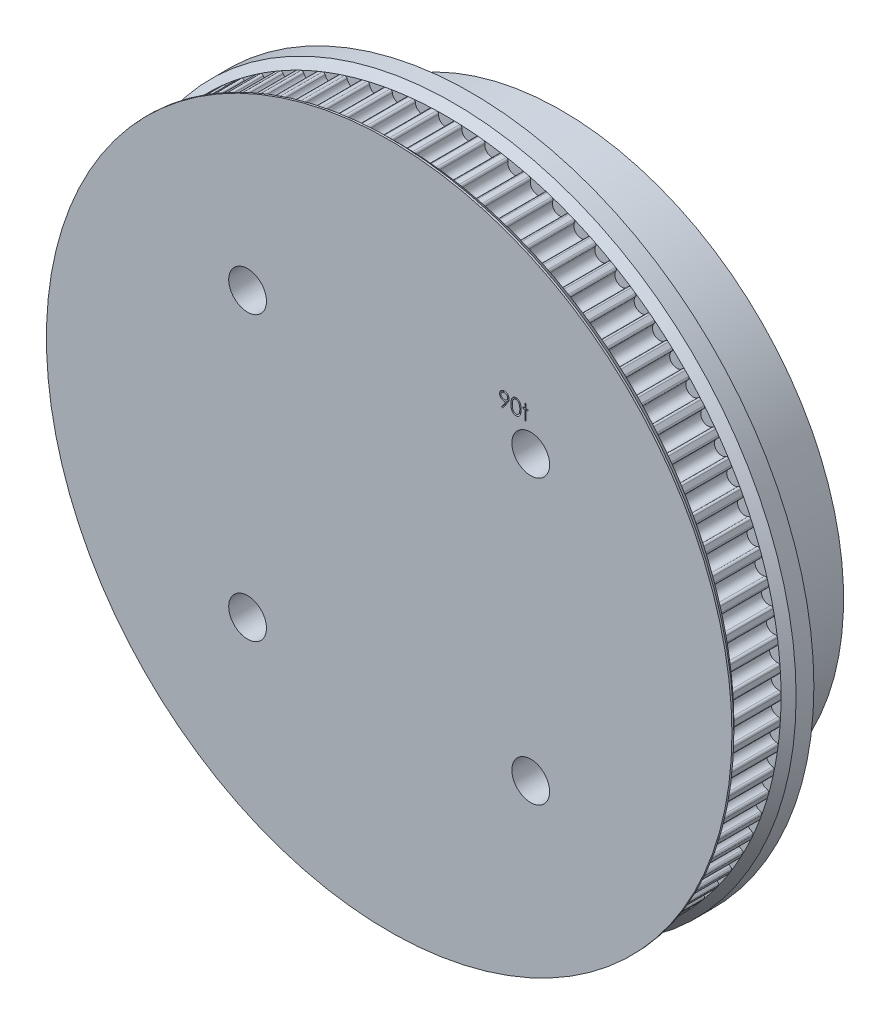
from build123d import *

# Parameters (mm, degrees)
SKETCH1_R           = 71.029724391
BOSS_EXTRUDE1_DEPTH = 10
CUT_EXTRUDE1_DEPTH  = 101.947726543
CIRPATTERN3_COUNT   = 90
CUT_EXTRUDE5_DEPTH  = 1
SKETCH10_R          = 72.629724391
BOSS_EXTRUDE3_DEPTH = 3.365
SKETCH11_R          = 59.75
BOSS_EXTRUDE4_DEPTH = 19.175
SKETCH12_R          = 2.15
CUT_EXTRUDE6_DEPTH  = 110.019839293
SKETCH13_R          = 4
CUT_EXTRUDE7_DEPTH  = 10


with BuildPart() as part:
    # Sketch1 → Boss-Extrude1 (new body)
    with BuildSketch(Plane.XY):
        Circle(SKETCH1_R)
    extrude(amount=BOSS_EXTRUDE1_DEPTH)

    # Sketch1<5> → Cut-Extrude1 (cut, through all)
    with BuildSketch(Plane.XY):
        with BuildLine():
            ThreePointArc((3.523854408, 70.9422596), (3.258115698, 70.954960568), (2.992331281, 70.966666123))
            ThreePointArc((2.992331281, 70.966666123), (3.300458942, 70.817165102), (3.401631166, 70.489968843))
            ThreePointArc((3.401631166, 70.489968843), (6.389656914, 69.925169615), (3.523854408, 70.9422596))
        make_face()
        with BuildLine():
            ThreePointArc((1.433411393, 71.015259479), (-1.496358772, 70.200555347), (1.523786697, 70.555544627))
            ThreePointArc((1.523786697, 70.555544627), (1.647536515, 70.874886412), (1.965342224, 71.002529371))
            ThreePointArc((1.965342224, 71.002529371), (1.699388729, 71.009392513), (1.433411393, 71.015259479))
        make_face()
    cut_extrude1 = extrude(amount=CUT_EXTRUDE1_DEPTH, mode=Mode.SUBTRACT)

    # CirPattern3: Cut-Extrude1 ×90 about axis
    cirpattern3_axis = Axis((0, 0, 10), (0, 0, 1))
    for i in range(1, CIRPATTERN3_COUNT):
        add(cut_extrude1.rotate(cirpattern3_axis, i * 360 / CIRPATTERN3_COUNT), mode=Mode.SUBTRACT)

    # Sketch5 → Revolve1 (revolve)
    with BuildSketch(Plane(origin=(0, 0, 0), x_dir=(0, 0, -1), z_dir=(1, 0, 0))):
        Polygon((0, 71.029724391), (0, 0), (2, 0), (2, 72.629724391), (1.6, 72.629724391), align=None)
    revolve1 = revolve(axis=Axis((0, 0, -1.6), (0, 0, -1)))

    # Mirror1: Revolve1 across plane
    add(revolve1.mirror(Plane.XY.offset(5)))

    # Sketch9 → Cut-Extrude5 (cut)
    # profile 1 of 3: a face of its own
    with BuildSketch(Plane.XY.offset(12)):
        with BuildLine():
            Line((24.056835363, 35.413500522), (23.829141052, 35.571868912))
            Line((23.829141052, 35.571868912), (24.71193352, 36.862348679))
            add(Edge.make_bspline(
                [(24.71193352, 36.862348679), (24.655608353, 36.855460686), (24.544700958, 36.841897844), (24.432998015, 36.839406235), (24.378024265, 36.838180009)],
                knots=[0, 0, 0, 0, 1.015715272, 2, 2, 2, 2], degree=3))
            add(Edge.make_bspline(
                [(24.378024265, 36.838180009), (24.344693979, 36.8390337), (24.279269542, 36.840709421), (24.183083686, 36.853991632), (24.090658927, 36.87444782), (24.002240297, 36.904972048), (23.91749546, 36.942907137), (23.83660942, 36.989948857), (23.759691063, 37.045290278), (23.687566484, 37.108638778), (23.621969406, 37.178196725), (23.563528272, 37.251816487), (23.514958816, 37.330353261), (23.4746122, 37.41220496), (23.44401386, 37.498548042), (23.421732129, 37.588399998), (23.408013993, 37.682390559), (23.406381957, 37.746366928), (23.405553312, 37.778850082)],
                knots=[0, 0, 0, 0, 1.060718605, 2.082097864, 3.085795603, 4.069760067, 5.054557537, 6.03741023, 7.043284206, 8.066802108, 9.088538119, 10.083643548, 11.053783639, 12.022749082, 12.983451788, 13.964007469, 14.966251758, 16, 16, 16, 16], degree=3))
            add(Edge.make_bspline(
                [(23.405553312, 37.778850082), (23.407126692, 37.823271645), (23.410214918, 37.910462163), (23.435069287, 38.037855654), (23.475945452, 38.158312018), (23.532939765, 38.271514551), (23.604726262, 38.375834836), (23.691003341, 38.469822646), (23.791246222, 38.552141192), (23.90317134, 38.622902033), (24.02414158, 38.679811638), (24.150841006, 38.721757289), (24.282298815, 38.746430439), (24.371350915, 38.749683327), (24.416185323, 38.751321035)],
                knots=[0, 0, 0, 0, 1.022988612, 2.007919123, 2.978103895, 3.94594894, 4.918897164, 5.887013414, 6.875921846, 7.89917871, 8.930658928, 9.948724884, 10.967259574, 12, 12, 12, 12], degree=3))
            add(Edge.make_bspline(
                [(24.416185323, 38.751321035), (24.460171246, 38.749660816), (24.547083285, 38.746380379), (24.674889741, 38.722355635), (24.797300521, 38.681863797), (24.913637045, 38.625907085), (25.021350654, 38.555765976), (25.118211569, 38.472186801), (25.202009379, 38.375117501), (25.272606757, 38.2669058), (25.329276007, 38.150640038), (25.370163007, 38.029278908), (25.395332265, 37.903695211), (25.398503933, 37.818610224), (25.400104594, 37.775669993)],
                knots=[0, 0, 0, 0, 1.026385292, 2.028040595, 3.023318987, 4.028184125, 5.03290303, 6.015178782, 7.004435299, 8.016004309, 9.023023918, 10.015172535, 10.998308025, 12, 12, 12, 12], degree=3))
            add(Edge.make_bspline(
                [(25.400104594, 37.775669993), (25.399035608, 37.742338148), (25.396867439, 37.674732836), (25.381685218, 37.572016739), (25.35590405, 37.467285981), (25.326647152, 37.378638533), (25.298405828, 37.305424439), (25.271825516, 37.247592649), (25.242332348, 37.186722217), (25.207934611, 37.123451418), (25.170957384, 37.05697369), (25.129175041, 36.987955798), (25.083540701, 36.916305125), (25.051038026, 36.86800241), (25.034394457, 36.843268151)],
                knots=[0, 0, 0, 0, 1.179839688, 2.393009684, 3.667231171, 4.993948276, 5.694988576, 6.444077775, 7.246288328, 8.089075292, 8.993003841, 9.939041771, 10.944649915, 12, 12, 12, 12], degree=3))
            Line((25.034394457, 36.843268151), (24.056835363, 35.413500522))
        make_face()
        with BuildLine():
            add(Edge.make_bspline(
                [(24.430813728, 37.163821035), (24.456063155, 37.164510812), (24.505215206, 37.165853573), (24.577221756, 37.174026242), (24.645188712, 37.188516929), (24.709297631, 37.209308382), (24.770191321, 37.234396932), (24.826902561, 37.266339234), (24.879478815, 37.304454324), (24.928272149, 37.347280553), (24.97160092, 37.394860725), (25.010193527, 37.444660243), (25.042996327, 37.496897711), (25.0689073, 37.552227313), (25.090211165, 37.609302209), (25.104923218, 37.669041517), (25.113073292, 37.731133995), (25.114462649, 37.77331492), (25.115168696, 37.794750522)],
                knots=[0, 0, 0, 0, 1.163407946, 2.26475976, 3.333800367, 4.359385343, 5.366239384, 6.363380779, 7.350133999, 8.353570782, 9.349036268, 10.310270964, 11.253520213, 12.184142, 13.120487599, 14.056272588, 15.012232024, 16, 16, 16, 16], degree=3))
            add(Edge.make_bspline(
                [(25.115168696, 37.794750522), (25.114561211, 37.816195076), (25.113364086, 37.858454199), (25.103759892, 37.920638606), (25.086864154, 37.980231778), (25.064194215, 38.037559968), (25.034330856, 38.092152162), (24.998495551, 38.14469376), (24.955921115, 38.194851619), (24.906933072, 38.24144609), (24.854106014, 38.284397399), (24.797808274, 38.322303339), (24.738503886, 38.354072567), (24.676554656, 38.380288061), (24.611831511, 38.400745743), (24.54437275, 38.41545721), (24.473837489, 38.423595873), (24.425957323, 38.424976449), (24.401556917, 38.425680009)],
                knots=[0, 0, 0, 0, 0.972161553, 1.915763587, 2.844109794, 3.775983486, 4.705125789, 5.659731448, 6.655561913, 7.682237399, 8.721216875, 9.739758359, 10.754845918, 11.767244016, 12.7857855, 13.828538656, 14.893392813, 16, 16, 16, 16], degree=3))
            add(Edge.make_bspline(
                [(24.401556917, 38.425680009), (24.377368721, 38.424975312), (24.329911679, 38.423592702), (24.260003478, 38.41547268), (24.193000847, 38.400646805), (24.128465234, 38.380297537), (24.066517845, 38.354070611), (24.007216254, 38.322301674), (23.950905346, 38.284406124), (23.898128935, 38.241412295), (23.849054391, 38.195068502), (23.807211947, 38.144474034), (23.77129463, 38.092179494), (23.741472306, 38.037552704), (23.718791452, 37.980233717), (23.701898636, 37.920638081), (23.692293657, 37.858454336), (23.69109664, 37.816195122), (23.690489209, 37.794750522)],
                knots=[0, 0, 0, 0, 1.099389452, 2.15699305, 3.192601482, 4.213358962, 5.227959689, 6.245255729, 7.266013209, 8.307253147, 9.336162325, 10.327954924, 11.284637477, 12.215801273, 13.149702402, 14.080068371, 15.025723358, 16, 16, 16, 16], degree=3))
            add(Edge.make_bspline(
                [(23.690489209, 37.794750522), (23.691038871, 37.773298228), (23.692122904, 37.730990376), (23.702580256, 37.668827149), (23.72006841, 37.609238573), (23.743490286, 37.551645246), (23.774334585, 37.496607203), (23.812184076, 37.444385382), (23.856548393, 37.394387795), (23.906834485, 37.347391253), (23.961869174, 37.304254636), (24.020649079, 37.266580647), (24.082162288, 37.234764929), (24.146625339, 37.209236674), (24.213560508, 37.188724665), (24.283569377, 37.174052949), (24.356420421, 37.165931964), (24.405778047, 37.164531429), (24.430813728, 37.163821035)],
                knots=[0, 0, 0, 0, 0.952633368, 1.87876736, 2.791047057, 3.707742249, 4.635551637, 5.587206343, 6.568248508, 7.601284464, 8.641511608, 9.671105535, 10.699146789, 11.713763218, 12.747829548, 13.806491675, 14.887386225, 16, 16, 16, 16], degree=3))
        make_face(mode=Mode.SUBTRACT)
    # profile 2 of 3: a face of its own
    with BuildSketch(Plane.XY.offset(12)):
        with BuildLine():
            add(Edge.make_bspline(
                [(25.807155876, 37.081138743), (25.807453435, 37.132027088), (25.808031448, 37.230878431), (25.814461659, 37.374918785), (25.825143576, 37.510047047), (25.839782479, 37.636269685), (25.857596932, 37.753619286), (25.881378124, 37.861782244), (25.908422595, 37.961259173), (25.939766599, 38.05237446), (25.975134094, 38.136355662), (26.01362803, 38.214755666), (26.056776094, 38.287455848), (26.102112293, 38.355616557), (26.151471815, 38.418122052), (26.203450004, 38.475855039), (26.260075563, 38.52748122), (26.319423578, 38.574513222), (26.38203137, 38.615742386), (26.44611436, 38.652057799), (26.512113635, 38.683081964), (26.580209387, 38.707475431), (26.649789564, 38.727623842), (26.721097403, 38.741402387), (26.79425064, 38.750071869), (26.843627728, 38.750900696), (26.868669297, 38.751321035)],
                knots=[0, 0, 0, 0, 1.646270934, 3.197905019, 4.663502075, 6.030701355, 7.308322542, 8.50163776, 9.611534131, 10.641858119, 11.616356847, 12.558055219, 13.465016945, 14.349605745, 15.204443733, 16.039544428, 16.859896111, 17.680448484, 18.487036065, 19.28249412, 20.06191084, 20.843045899, 21.620316918, 22.403196591, 23.190181807, 24, 24, 24, 24], degree=3))
            add(Edge.make_bspline(
                [(26.868669297, 38.751321035), (26.893920053, 38.750878517), (26.944135861, 38.749998488), (27.018376773, 38.74154034), (27.090902555, 38.727505821), (27.16140401, 38.707620366), (27.230460247, 38.682950002), (27.297531132, 38.652028117), (27.36303327, 38.616033716), (27.425925745, 38.573739199), (27.486899003, 38.526583848), (27.54445537, 38.473277713), (27.598600083, 38.414359039), (27.650012682, 38.350458205), (27.697234545, 38.280349593), (27.74220473, 38.205252579), (27.782456505, 38.123853866), (27.821222961, 38.037511584), (27.854684727, 37.943836694), (27.884861964, 37.843357232), (27.909245028, 37.734886363), (27.929555297, 37.618993197), (27.945289595, 37.495252123), (27.956749206, 37.363928394), (27.962802648, 37.224935611), (27.963942655, 37.129905277), (27.964527671, 37.081138743)],
                knots=[0, 0, 0, 0, 0.810914788, 1.612654377, 2.396697861, 3.181598691, 3.963628158, 4.749916497, 5.551656086, 6.361998678, 7.18212741, 8.025565596, 8.878627764, 9.750805457, 10.657531673, 11.591944965, 12.560506719, 13.57287815, 14.630710178, 15.753379473, 16.941251878, 18.199788006, 19.531962791, 20.947069417, 22.433333509, 24, 24, 24, 24], degree=3))
            add(Edge.make_bspline(
                [(27.964527671, 37.081138743), (27.96393659, 37.032584913), (27.962784895, 36.937979754), (27.956817068, 36.799612369), (27.945061738, 36.668985572), (27.930356963, 36.545786081), (27.909990732, 36.43052667), (27.884948903, 36.322808492), (27.857144681, 36.22216637), (27.822823118, 36.129424791), (27.785257688, 36.043290013), (27.744386189, 35.962856243), (27.700598561, 35.887412535), (27.652893056, 35.817562764), (27.602044603, 35.752812125), (27.546964895, 35.694303568), (27.489206578, 35.640627315), (27.428053887, 35.592864767), (27.364180551, 35.551059266), (27.298903388, 35.513672416), (27.231064176, 35.483525614), (27.162200283, 35.457640256), (27.091326694, 35.437864131), (27.018531754, 35.424189991), (26.94418574, 35.414599814), (26.893928606, 35.413868222), (26.868669297, 35.413500522)],
                knots=[0, 0, 0, 0, 1.561518951, 3.042555995, 4.452378317, 5.7783523, 7.031515105, 8.214008947, 9.334062868, 10.386615937, 11.391082383, 12.354592575, 13.286541444, 14.194233754, 15.072674879, 15.931287219, 16.775624067, 17.606195743, 18.42308326, 19.229000347, 20.022332153, 20.807536673, 21.593273796, 22.3848459, 23.188221202, 24, 24, 24, 24], degree=3))
            add(Edge.make_bspline(
                [(26.868669297, 35.413500522), (26.843628422, 35.413923573), (26.794252705, 35.414757747), (26.721089433, 35.423388061), (26.650076074, 35.437263267), (26.580862204, 35.456691187), (26.513092723, 35.480471788), (26.447691091, 35.511454058), (26.383930121, 35.547135678), (26.321979924, 35.587771525), (26.263004606, 35.634327623), (26.2066723, 35.685820942), (26.154398175, 35.743536465), (26.105744389, 35.806562867), (26.059503609, 35.874320308), (26.016968249, 35.947733904), (25.977624688, 36.026512557), (25.941662379, 36.111165234), (25.90977752, 36.202927204), (25.881612813, 36.302848244), (25.85937497, 36.411810286), (25.840340432, 36.528938183), (25.824987599, 36.654735248), (25.814506175, 36.789269776), (25.808027982, 36.93245793), (25.807451883, 37.030674082), (25.807155876, 37.081138743)],
                knots=[0, 0, 0, 0, 0.810891512, 1.598919785, 2.382837074, 3.152667961, 3.926044502, 4.706494248, 5.493654104, 6.291793342, 7.103789334, 7.925228297, 8.761435821, 9.622817696, 10.50288917, 11.416980706, 12.369136599, 13.353924996, 14.394355917, 15.514179734, 16.714354668, 17.994756427, 19.357759367, 20.818452758, 22.365282078, 24, 24, 24, 24], degree=3))
        make_face()
        with BuildLine():
            add(Edge.make_bspline(
                [(26.092091773, 37.082410779), (26.092200129, 37.040003031), (26.092410426, 36.957697918), (26.097904265, 36.838097246), (26.105388404, 36.726545591), (26.11504158, 36.622901311), (26.129377112, 36.527515228), (26.145439698, 36.439731302), (26.164986894, 36.360014094), (26.188114517, 36.28781658), (26.214457127, 36.221913496), (26.243218874, 36.160589537), (26.274116816, 36.10312028), (26.308696331, 36.050021935), (26.346356424, 36.001121343), (26.386246452, 35.955552988), (26.429855154, 35.914915727), (26.490183549, 35.866177794), (26.569827493, 35.815814008), (26.670176049, 35.771957198), (26.773289572, 35.74439597), (26.843276778, 35.740890991), (26.878209562, 35.739141548)],
                knots=[0, 0, 0, 0, 1.459021318, 2.831673884, 4.118529203, 5.306027144, 6.411944654, 7.436330062, 8.375795394, 9.233974572, 10.042671642, 10.816086306, 11.563610507, 12.285937304, 12.993564865, 13.685989202, 14.367179055, 15.041617293, 16.353048772, 17.594441528, 18.799311195, 20, 20, 20, 20], degree=3))
            add(Edge.make_bspline(
                [(26.878209562, 35.739141548), (26.913368307, 35.740590963), (26.983613207, 35.743486802), (27.086241721, 35.771425656), (27.185873466, 35.813580167), (27.263953012, 35.863425404), (27.323355034, 35.910894675), (27.365915446, 35.951366534), (27.404978876, 35.996683642), (27.442028472, 36.045578004), (27.476009205, 36.098983757), (27.506909337, 36.156644093), (27.535106374, 36.218719133), (27.551171008, 36.262053111), (27.559384441, 36.284208655)],
                knots=[0, 0, 0, 0, 1.353760809, 2.704726607, 4.075137775, 5.516104923, 6.260822281, 7.007110065, 7.778089737, 8.566572457, 9.372053459, 10.217411131, 11.088608312, 12, 12, 12, 12], degree=3))
            add(Edge.make_bspline(
                [(27.559384441, 36.284208655), (27.568956402, 36.31253849), (27.588391588, 36.370060205), (27.613439411, 36.45929009), (27.633165595, 36.55290974), (27.650912363, 36.650359667), (27.663025492, 36.752358539), (27.672775294, 36.858590758), (27.678518131, 36.969136423), (27.679230013, 37.044243307), (27.679591773, 37.082410779)],
                knots=[0, 0, 0, 0, 0.884706709, 1.796334032, 2.740027952, 3.714592787, 4.726048262, 5.777819803, 6.87074269, 8, 8, 8, 8], degree=3))
            add(Edge.make_bspline(
                [(27.679591773, 37.082410779), (27.679092673, 37.120572077), (27.678116326, 37.195223733), (27.674384352, 37.30455094), (27.664747252, 37.408389552), (27.654043766, 37.507186909), (27.638262001, 37.600396112), (27.62124599, 37.688797461), (27.59838489, 37.771295776), (27.573964809, 37.849182682), (27.546015379, 37.921573276), (27.515248963, 37.988805068), (27.482390653, 38.05120264), (27.44670162, 38.108594794), (27.408605536, 38.1612386), (27.367096903, 38.208078554), (27.323822222, 38.250566375), (27.263209489, 38.299064563), (27.183857811, 38.348514458), (27.08511926, 38.394021969), (26.982366604, 38.420155206), (26.912903542, 38.423839736), (26.878209562, 38.425680009)],
                knots=[0, 0, 0, 0, 1.31362396, 2.569729283, 3.763502607, 4.902122613, 5.988968491, 7.01645872, 7.998833611, 8.933434873, 9.825090667, 10.667526885, 11.477055099, 12.250526234, 12.991942729, 13.710640831, 14.402115721, 15.076753259, 16.378508321, 17.609869233, 18.806226677, 20, 20, 20, 20], degree=3))
            add(Edge.make_bspline(
                [(26.878209562, 38.425680009), (26.843093525, 38.423837197), (26.772797477, 38.420148215), (26.668976833, 38.394119335), (26.569459314, 38.348750431), (26.490317472, 38.298900778), (26.429662466, 38.251422453), (26.386951737, 38.210250455), (26.346904852, 38.16521421), (26.310013439, 38.115863902), (26.275461017, 38.062827462), (26.243728242, 38.005687654), (26.215137521, 37.944154916), (26.188753692, 37.878281435), (26.16555552, 37.80609015), (26.146420282, 37.726471134), (26.128742741, 37.638966418), (26.116228461, 37.543063722), (26.105103483, 37.439393483), (26.097953974, 37.327563344), (26.092392048, 37.207762085), (26.092193869, 37.125031419), (26.092091773, 37.082410779)],
                knots=[0, 0, 0, 0, 1.207732386, 2.417664972, 3.655092373, 4.956220595, 5.625982001, 6.301752483, 6.994047911, 7.697131622, 8.419323945, 9.170223765, 9.943494443, 10.752040957, 11.610060368, 12.549350801, 13.567764191, 14.679664412, 15.874934091, 17.154273443, 18.533957287, 20, 20, 20, 20], degree=3))
        make_face(mode=Mode.SUBTRACT)
    # profile 3 of 3: a face of its own
    with BuildSketch(Plane.XY.offset(12)):
        Polygon((28.737925107, 38.751321035), (29.022861004, 38.751321035), (29.022861004, 37.815103086), (29.429912286, 37.815103086), (29.429912286, 37.530167189), (29.022861004, 37.530167189), (29.022861004, 35.494910779), (28.737925107, 35.494910779), (28.737925107, 37.530167189), (28.330873824, 37.530167189), (28.330873824, 37.815103086), (28.737925107, 37.815103086), align=None)
    extrude(amount=-CUT_EXTRUDE5_DEPTH, mode=Mode.SUBTRACT)

    # Sketch10 → Boss-Extrude3 (add)
    with BuildSketch(Plane(origin=(0, 0, -2), x_dir=(-1, 0, 0), z_dir=(0, 0, -1))):
        Circle(SKETCH10_R)
    extrude(amount=BOSS_EXTRUDE3_DEPTH)

    # Sketch11 → Boss-Extrude4 (add)
    with BuildSketch(Plane(origin=(0, 0, -5.365), x_dir=(-1, 0, 0), z_dir=(0, 0, -1))):
        Circle(SKETCH11_R)
    extrude(amount=BOSS_EXTRUDE4_DEPTH)

    # Sketch12 → Cut-Extrude6 (cut, through all)
    with BuildSketch(Plane.XY.offset(12)):
        with Locations((-30, 30)):
            Circle(SKETCH12_R)
        with Locations((30, 30)):
            Circle(SKETCH12_R)
        with Locations((30, -30)):
            Circle(SKETCH12_R)
        with Locations((-30, -30)):
            Circle(SKETCH12_R)
    extrude(amount=-CUT_EXTRUDE6_DEPTH, mode=Mode.SUBTRACT)

    # Sketch13 → Cut-Extrude7 (cut)
    with BuildSketch(Plane.XY.offset(12)):
        with Locations((-30, 30)):
            Circle(SKETCH13_R)
        with Locations((30, 30)):
            Circle(SKETCH13_R)
        with Locations((30, -30)):
            Circle(SKETCH13_R)
        with Locations((-30, -30)):
            Circle(SKETCH13_R)
    extrude(amount=-CUT_EXTRUDE7_DEPTH, mode=Mode.SUBTRACT)


solid = part.part
